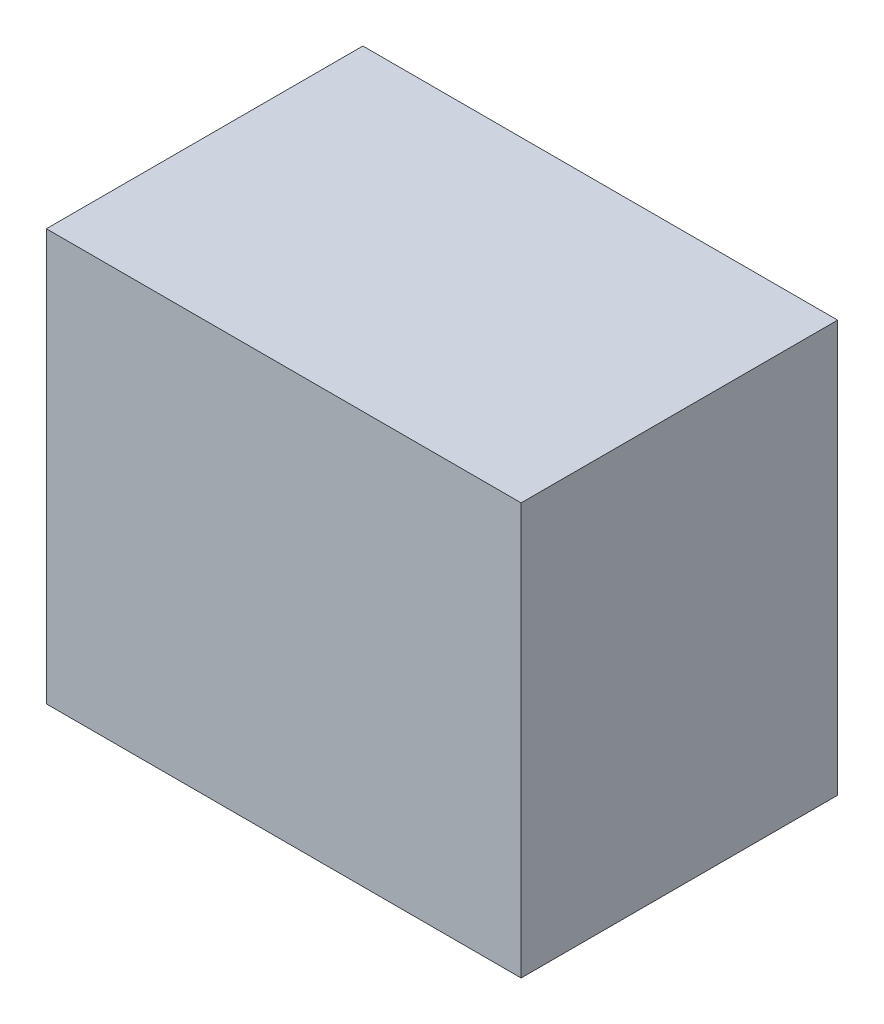
from build123d import *

# Parameters (mm, degrees)
SKETCH1_W                = 1500
SKETCH1_H                = 1300
BOSS_EXTRUDE3_DEPTH      = 1000
SKETCH5_W                = 820
SKETCH5_H                = 1020
SKETCH5_W_2              = 800
SKETCH5_H_2              = 1000
CUT_EXTRUDE_THIN5_DEPTH  = 900
CUT_EXTRUDE_THIN9_START  = -900
CUT_EXTRUDE_THIN9_DEPTH  = 900
CUT_EXTRUDE_THIN25_DEPTH = 900
CUT_EXTRUDE_THIN26_DEPTH = 900


# Read off the part's stored shape, not the designer's step: Cut-Extrude-Thin9
with BuildPart() as part:
    # Sketch1 → Boss-Extrude3 (new body)
    with BuildSketch(Plane(origin=(-226.705899875, 34.53488644, 0), x_dir=(1, 0, 0), z_dir=(0, 0, 1))):
        with Locations((666.978508717, -609.518449502)):
            Rectangle(SKETCH1_W, SKETCH1_H)
    extrude(amount=BOSS_EXTRUDE3_DEPTH)

    # Sketch5 → Cut-Extrude-Thin5 (cut)
    with BuildSketch(Plane(origin=(0, 0, 0), x_dir=(-1, 0, 0), z_dir=(0, 0, -1))):
        with Locations((-440.09863574, -578.647805533)):
            Rectangle(SKETCH5_W, SKETCH5_H)
        with Locations((-440.09863574, -578.647805533)):
            Rectangle(SKETCH5_W_2, SKETCH5_H_2, mode=Mode.SUBTRACT)
    extrude(amount=-CUT_EXTRUDE_THIN5_DEPTH, mode=Mode.SUBTRACT)

    # Cut-Extrude-Thin9 outline → Cut-Extrude-Thin9 (cut)
    with BuildSketch(Plane(origin=(0, 0, 0), x_dir=(-1, 0, 0), z_dir=(0, 0, -1)).offset(CUT_EXTRUDE_THIN9_START)):
        with BuildLine():
            ThreePointArc((-840.09863574, -612.777474084), (-810.032843418, -828.647805533), (-840.09863574, -1044.518136982))
            Line((-840.09863574, -1044.518136982), (-840.09863574, -1078.647805533))
            ThreePointArc((-840.09863574, -1078.647805533), (-800.032843418, -828.647805533), (-840.09863574, -578.647805533))
            Line((-840.09863574, -578.647805533), (-840.09863574, -612.777474084))
        make_face()
        with BuildLine():
            ThreePointArc((-40.09863574, -511.526312309), (-65.332815003, -313.452489118), (-40.09863574, -115.378665927))
            Line((-40.09863574, -115.378665927), (-40.09863574, -78.647805533))
            ThreePointArc((-40.09863574, -78.647805533), (-75.332815003, -313.452489118), (-40.09863574, -548.257172703))
            Line((-40.09863574, -548.257172703), (-40.09863574, -511.526312309))
        make_face()
        with BuildLine():
            ThreePointArc((-20.598154948, -575.520367878), (-25.486318472, -561.181617873), (-30.09863574, -546.751772975))
            Line((-30.09863574, -546.751772975), (-30.09863574, -578.647805533))
            ThreePointArc((-30.09863574, -578.647805533), (5.135543524, -813.452489118), (-30.09863574, -1048.257172703))
            Line((-30.09863574, -1048.257172703), (-30.09863574, -1080.348048155))
            ThreePointArc((-30.09863574, -1080.348048155), (14.992145049, -828.693386929), (-20.598154948, -575.520367878))
        make_face()
        with BuildLine():
            Line((-850.09863574, -111.389167393), (-850.09863574, -77.050278028))
            ThreePointArc((-850.09863574, -77.050278028), (-890.164428061, -328.647805533), (-850.09863574, -580.245333038))
            Line((-850.09863574, -580.245333038), (-850.09863574, -545.906443673))
            ThreePointArc((-850.09863574, -545.906443673), (-880.164428061, -328.647805533), (-850.09863574, -111.389167393))
        make_face()
    extrude(amount=CUT_EXTRUDE_THIN9_DEPTH, mode=Mode.SUBTRACT)

    # Sketch8 → Cut-Extrude-Thin25 (cut)
    with BuildSketch(Plane(origin=(0, 0, 0), x_dir=(-1, 0, 0), z_dir=(0, 0, -1))):
        with BuildLine():
            ThreePointArc((-44.204558678, -575.794492227), (-232.775541237, -750.064076456), (-477.220833635, -828.647805533))
            ThreePointArc((-477.220833635, -828.647805533), (-232.775541237, -907.231534609), (-44.204558678, -1081.501118839))
            Line((-44.204558678, -1081.501118839), (-35.992712801, -1075.794492227))
            ThreePointArc((-35.992712801, -1075.794492227), (-199.246048012, -916.307353384), (-409.967671451, -828.647805533))
            ThreePointArc((-409.967671451, -828.647805533), (-199.246048012, -740.988257682), (-35.992712801, -581.501118839))
            Line((-35.992712801, -581.501118839), (-44.204558678, -575.794492227))
        make_face()
        with BuildLine():
            ThreePointArc((-844.201980979, -81.504824582), (-680.110140526, -241.301950512), (-468.374562106, -328.647805533))
            ThreePointArc((-468.374562106, -328.647805533), (-680.110140526, -415.993660554), (-844.201980979, -575.790786484))
            Line((-844.201980979, -575.790786484), (-835.9952905, -581.504824582))
            ThreePointArc((-835.9952905, -581.504824582), (-645.344725951, -406.290174443), (-398.323524561, -328.647805533))
            ThreePointArc((-398.323524561, -328.647805533), (-645.344725951, -251.005436622), (-835.9952905, -75.790786484))
            Line((-835.9952905, -75.790786484), (-844.201980979, -81.504824582))
        make_face()
    extrude(amount=-CUT_EXTRUDE_THIN25_DEPTH, mode=Mode.SUBTRACT)

    # Sketch9 → Cut-Extrude-Thin26 (cut)
    with BuildSketch(Plane(origin=(0, 0, 0), x_dir=(-1, 0, 0), z_dir=(0, 0, -1))):
        with BuildLine():
            ThreePointArc((-30.09863574, -173.647805533), (44.147576285, 5.598406492), (-135.09863574, -68.647805533))
            Line((-135.09863574, -68.647805533), (-125.09863574, -68.647805533))
            ThreePointArc((-125.09863574, -68.647805533), (37.076508473, -1.47266132), (-30.09863574, -163.647805533))
            Line((-30.09863574, -163.647805533), (-30.09863574, -173.647805533))
        make_face()
        with BuildLine():
            ThreePointArc((-850.09863574, -983.647805533), (-924.344847764, -1162.894017558), (-745.09863574, -1088.647805533))
            Line((-745.09863574, -1088.647805533), (-755.09863574, -1088.647805533))
            ThreePointArc((-755.09863574, -1088.647805533), (-917.273779952, -1155.822949746), (-850.09863574, -993.647805533))
            Line((-850.09863574, -993.647805533), (-850.09863574, -983.647805533))
        make_face()
    extrude(amount=-CUT_EXTRUDE_THIN26_DEPTH, mode=Mode.SUBTRACT)


solid = part.part
